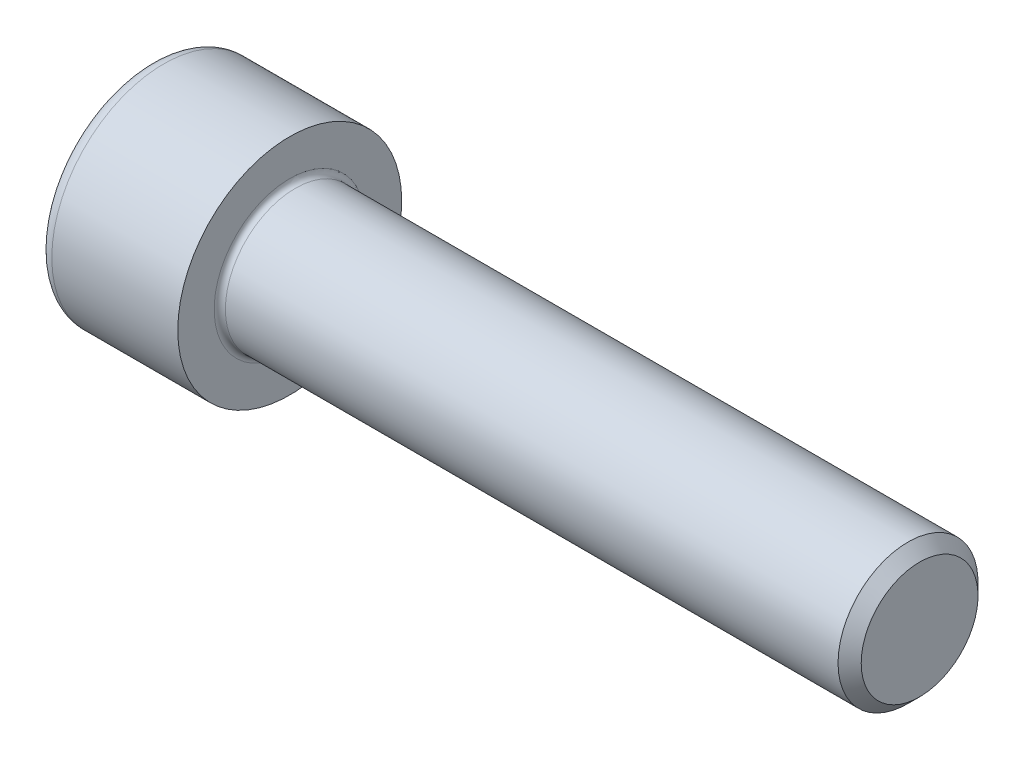
from build123d import *

# Parameters (mm, degrees)
FILLET1_R   = 0.4
FILLET2_R   = 1
HEX_2_DEPTH = 5


with BuildPart() as part:
    # BodySke → Base-Revolve (revolve)
    with BuildSketch(Plane.XY):
        Polygon((0, 0), (0, 8), (10, 8), (10, 5), (54.172, 5), (55, 4.172), (55, 0), align=None)
    revolve(axis=Axis((-31.75, 0, 0), (1, 0, 0)))

    # Fillet1
    fillet1_edges = [part.edges().sort_by_distance(p)[0] for p in [
        (10, -5, 0),
    ]]
    fillet(fillet1_edges, radius=FILLET1_R)

    # Fillet2
    fillet2_edges = [part.edges().sort_by_distance(p)[0] for p in [
        (0, -8, 0),
    ]]
    fillet(fillet2_edges, radius=FILLET2_R)

    # Sketch2 → Hex-PreBroach (revolve, cut)
    with BuildSketch(Plane.XY):
        Polygon((0, 4.0125), (5, 4.0125), (7.316617955, 0), (0, 0), align=None)
    revolve(axis=Axis((0, 0, 0), (1, 0, 0)), mode=Mode.SUBTRACT)

    # Sketch3 → Hex 2 (cut)
    with BuildSketch(Plane(origin=(0, 0, 0), x_dir=(0, 0.500000000000001, 0.866025403784438), z_dir=(-1, 0, 0))):
        Polygon((2.316617955, 4.0125), (-2.316617955, 4.0125), (-4.63323591, 0), (-2.316617955, -4.0125), (2.316617955, -4.0125), (4.63323591, 0), align=None)
    extrude(amount=-HEX_2_DEPTH, mode=Mode.SUBTRACT)


solid = part.part
